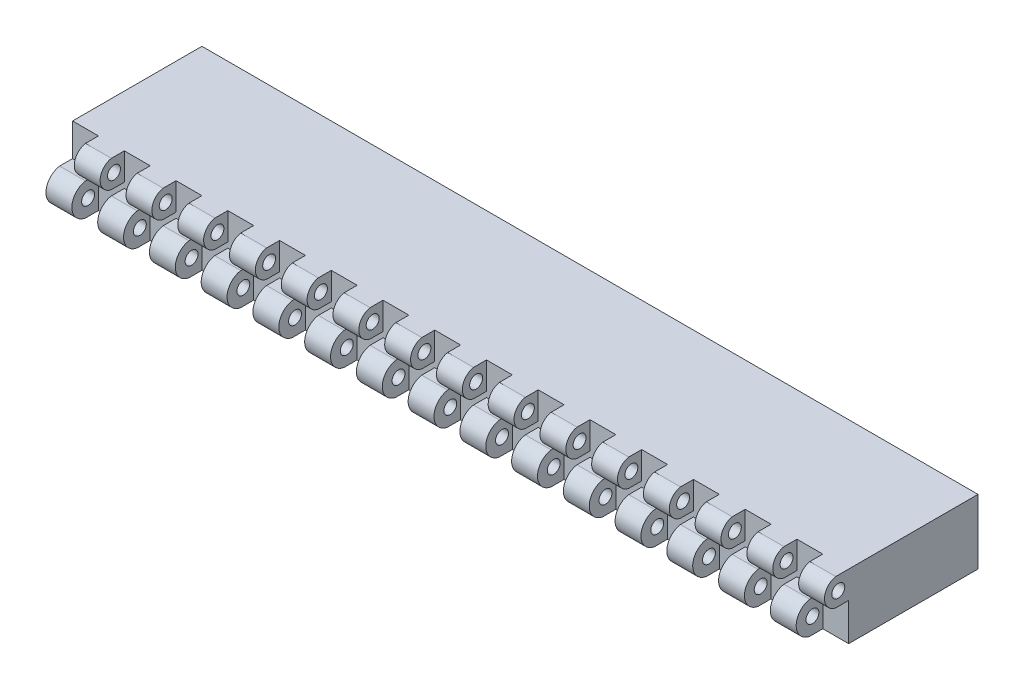
from build123d import *

# Parameters (mm, degrees)
SKETCH1_W           = 50
SKETCH1_H           = 25
BOSS_EXTRUDE1_DEPTH = 150
SKETCH2_R           = 2.5
BOSS_EXTRUDE2_DEPTH = 10
LPATTERN1_COUNT     = 15
LPATTERN1_PITCH     = 20
SKETCH3_R           = 2.5
BOSS_EXTRUDE3_DEPTH = 10
LPATTERN2_COUNT     = 15
LPATTERN2_PITCH     = 20
SKETCH4_R           = 7
CUT_EXTRUDE1_DEPTH  = 30


with BuildPart() as part:
    # Sketch1 → Boss-Extrude1 (new, symmetric)
    with BuildSketch(Plane(origin=(0, 0, 0), x_dir=(0, 0, -1), z_dir=(1, 0, 0))):
        Rectangle(SKETCH1_W, SKETCH1_H)
    extrude(amount=BOSS_EXTRUDE1_DEPTH, both=True)

    # Sketch2 → Boss-Extrude2 (add)
    with BuildSketch(Plane(origin=(150, 0, 0), x_dir=(0, 0, -1), z_dir=(1, 0, 0))):
        with BuildLine():
            Line((-25, 2), (-25, 12.5))
            Line((-25, 12.5), (-30, 12.5))
            ThreePointArc((-30, 12.5), (-34.344389582, 7.25), (-30, 2))
            Line((-30, 2), (-25, 2))
        make_face()
        with Locations((-29, 7.25)):
            Circle(SKETCH2_R, mode=Mode.SUBTRACT)
    boss_extrude2 = extrude(amount=-BOSS_EXTRUDE2_DEPTH)

    # LPattern1: Boss-Extrude2 ×15
    with Locations(*[(-i * LPATTERN1_PITCH, 0, 0) for i in range(1, LPATTERN1_COUNT)]):
        add(boss_extrude2)

    # Sketch3 → Boss-Extrude3 (add)
    with BuildSketch(Plane.ZY.offset(150)):
        with BuildLine():
            Line((25, -0.091015563), (25, -12.5))
            Line((25, -12.5), (30, -12.5))
            ThreePointArc((30, -12.5), (35.284562331, -6.295507781), (30, -0.091015563))
            Line((30, -0.091015563), (25, -0.091015563))
        make_face()
        with Locations((29, -6.295507781)):
            Circle(SKETCH3_R, mode=Mode.SUBTRACT)
    boss_extrude3 = extrude(amount=-BOSS_EXTRUDE3_DEPTH)

    # LPattern2: Boss-Extrude3 ×15
    with Locations(*[(i * LPATTERN2_PITCH, 0, 0) for i in range(1, LPATTERN2_COUNT)]):
        add(boss_extrude3)

    # Sketch4 → Cut-Extrude1 (cut)
    with BuildSketch(Plane(origin=(0, 0, -25), x_dir=(-1, 0, 0), z_dir=(0, 0, -1))):
        Circle(SKETCH4_R)
    extrude(amount=-CUT_EXTRUDE1_DEPTH, mode=Mode.SUBTRACT)


solid = part.part
